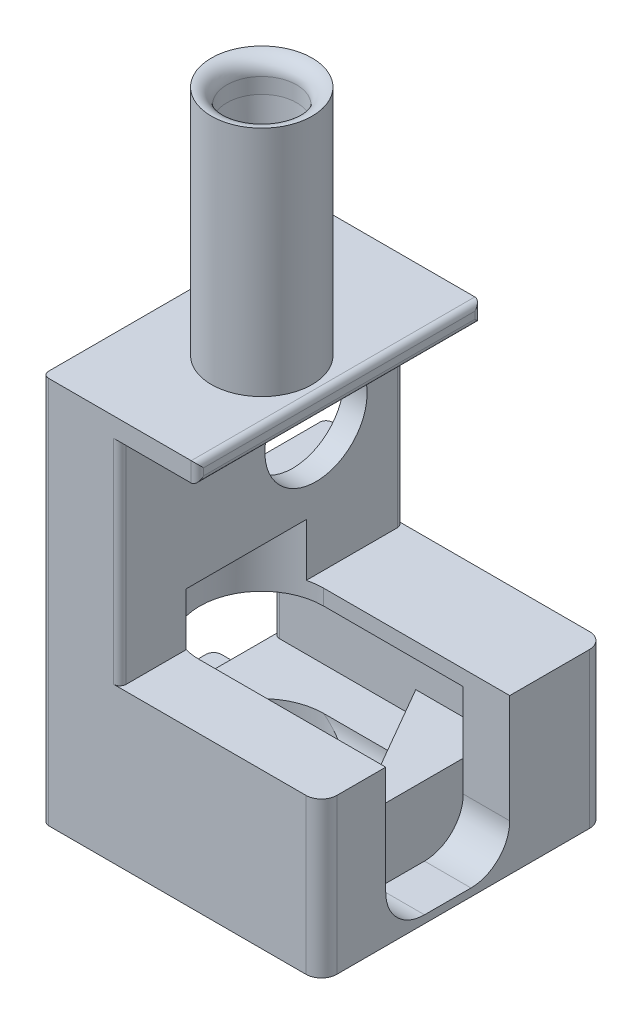
from build123d import *

# Parameters (mm, degrees)
SKETCH1_W                        = 12
SKETCH1_H                        = 13
BOSS_EXTRUDE1_DEPTH              = 19
SKETCH2_R                        = 4
CUT_EXTRUDE1_DEPTH               = 16
CUT_EXTRUDE2_START               = -2
SKETCH3_W                        = 12
SKETCH3_H                        = 13
CUT_EXTRUDE2_DEPTH               = 6
SKETCH5_W                        = 12
SKETCH5_H                        = 13
BOSS_EXTRUDE2_DEPTH              = 5
FILLET1_R                        = 2
FILLET4_R                        = 2
SKETCH21_W                       = 2.5
SKETCH21_H                       = 8
SKETCH21_W_2                     = 9
SKETCH21_H_2                     = 1.5
BOSS_EXTRUDE4_DEPTH              = 1.6
FILLET3_R                        = 0.5
FILLET7_R                        = 0.5
FILLET5_R                        = 0.5
SKETCH23_R                       = 4
BOSS_EXTRUDE5_DEPTH              = 1
BOSS_EXTRUDE6_DEPTH              = 13
BOSS_EXTRUDE7_DEPTH              = 25
SKETCH34_W                       = 13.5
SKETCH34_H                       = 6
CUT_EXTRUDE5_DEPTH               = 15
M2_5_CLEARANCE_HOLE1_D           = 2.9
M2_5_CLEARANCE_HOLE1_DEPTH       = 19.128752102
M2_5_CLEARANCE_HOLE1_TIP         = 0.871247898
FILLET8_R                        = 0.4
SKETCH31_R                       = 3.25
SKETCH31_R_2                     = 2.25
BOSS_EXTRUDE8_DEPTH              = 15
FILLET9_R                        = 1
SKETCH9_R                        = 1
CUT_EXTRUDE6_DEPTH               = 29.903676278
CUT_EXTRUDE8_DEPTH               = 12
BOSS_EXTRUDE9_START              = -2.5
BOSS_EXTRUDE9_DEPTH              = 4.5
FILLET10_R                       = 1
CUT_EXTRUDE9_REACH               = 45.94
SKETCH48_W                       = 12
SKETCH48_H                       = 15
CUT_EXTRUDE10_START              = -2.5
CUT_EXTRUDE10_DEPTH              = 5.5
SKETCH50_W                       = 16.3
SKETCH50_H                       = 8
CUT_EXTRUDE11_DEPTH              = 1
CUT_EXTRUDE13_DEPTH              = 8
SKETCH51_W                       = 2.5
SKETCH51_H                       = 8
BOSS_EXTRUDE10_DEPTH             = 5
BOSS_EXTRUDE10_DIRECTION_2_REACH = 43.91
CUT_EXTRUDE12_DEPTH              = 2.5
CUT_EXTRUDE14_START              = -1.25
CUT_EXTRUDE14_DEPTH              = 5.5
BOSS_EXTRUDE11_DEPTH             = 1.25
SKETCH58_R                       = 3.3
CUT_EXTRUDE16_DEPTH              = 6.6
SKETCH65_W                       = 1
SKETCH65_H                       = 16.3
CUT_EXTRUDE17_DEPTH              = 7
BOSS_EXTRUDE12_DEPTH             = 2
FILLET11_R                       = 1
CUT_EXTRUDE18_DEPTH              = 6.75
BOSS_EXTRUDE13_DEPTH             = 6.75
FILLET12_R                       = 0.4
FILLET13_R                       = 0.4
BOSS_EXTRUDE18_DEPTH             = 1.5
BOSS_EXTRUDE19_REACH             = 44.344


with BuildPart() as part:
    # Sketch1 → Boss-Extrude1 (new body)
    with BuildSketch(Plane(origin=(0, 0, 0), x_dir=(1, 0, 0), z_dir=(0, 1, 0))):
        Rectangle(SKETCH1_W, SKETCH1_H)
    extrude(amount=BOSS_EXTRUDE1_DEPTH)

    # Sketch2 → Cut-Extrude1 (cut)
    with BuildSketch(Plane.XZ):
        with Locations(Location((0, 0, 0), (0, 0, 270))):
            Circle(SKETCH2_R)
    extrude(amount=-CUT_EXTRUDE1_DEPTH, mode=Mode.SUBTRACT)

    # Sketch3 → Cut-Extrude2 (cut)
    with BuildSketch(Plane.XZ.offset(CUT_EXTRUDE2_START)):
        Rectangle(SKETCH3_W, SKETCH3_H)
    extrude(amount=-CUT_EXTRUDE2_DEPTH, mode=Mode.SUBTRACT)


with BuildPart() as cut_extrude2_piece_1:
    # of the separate pieces the step leaves, piece 1, a body of its own (cut_extrude2_pieces)
    add(part.part.solids().sort_by_distance((-6, 8, 6.5))[0])

    # Sketch5 → Boss-Extrude2 (add)
    with BuildSketch(Plane(origin=(0, 19, 0), x_dir=(1, 0, 0), z_dir=(0, 1, 0))):
        Rectangle(SKETCH5_W, SKETCH5_H)
    extrude(amount=BOSS_EXTRUDE2_DEPTH)

    # Fillet1
    fillet1_edges = [cut_extrude2_piece_1.edges().sort_by_distance(p)[0] for p in [
        (-6, 16, -6.5),
        (-6, 16, 6.5),
    ]]
    fillet(fillet1_edges, radius=FILLET1_R)



with BuildPart() as cut_extrude2_piece_2:
    # of the separate pieces the step leaves, piece 2, a body of its own (cut_extrude2_pieces)
    add(part.part.solids().sort_by_distance((-6, 0, 6.5))[0])

    # Fillet4
    fillet4_edges = [cut_extrude2_piece_2.edges().sort_by_distance(p)[0] for p in [
        (-6, 1, 6.5),
        (-6, 1, -6.5),
    ]]
    fillet(fillet4_edges, radius=FILLET4_R)

    # Sketch21 → Boss-Extrude4 (add)
    with BuildSketch(Plane.ZY.offset(6)):
        with Locations((-3.25, 18)):
            Rectangle(SKETCH21_W, SKETCH21_H)
        with Locations((3.25, 18)):
            Rectangle(SKETCH21_W, SKETCH21_H)
        with Locations((0, 0.75)):
            Rectangle(SKETCH21_W_2, SKETCH21_H_2)
    extrude(amount=BOSS_EXTRUDE4_DEPTH)


with BuildPart() as boss_extrude4_piece_1:
    # of the separate pieces the step leaves, piece 1, a body of its own (boss_extrude4_pieces)
    add(cut_extrude2_piece_2.part.solids().sort_by_distance((-4, 0, 6.5))[0])

    # Fillet5
    fillet5_edges = [boss_extrude4_piece_1.edges().sort_by_distance(p)[0] for p in [
        (-7.6, 0.75, -4.5),
        (-7.6, 0.75, 4.5),
    ]]
    fillet(fillet5_edges, radius=FILLET5_R)

    # Sketch23 → Boss-Extrude5 (add)
    with BuildSketch(Plane.XZ):
        with BuildLine():
            Line((-7.6, 4), (-7.6, -4))
            ThreePointArc((-7.6, -4), (-7.453553391, -4.353553391), (-7.1, -4.5))
            Line((-7.1, -4.5), (-6, -4.5))
            ThreePointArc((-6, -4.5), (-5.414213562, -5.914213562), (-4, -6.5))
            Line((-4, -6.5), (6, -6.5))
            Line((6, -6.5), (6, 6.5))
            Line((6, 6.5), (-4, 6.5))
            ThreePointArc((-4, 6.5), (-5.414213562, 5.914213562), (-6, 4.5))
            Line((-6, 4.5), (-7.1, 4.5))
            ThreePointArc((-7.1, 4.5), (-7.453553391, 4.353553391), (-7.6, 4))
        make_face()
        with Locations(Location((0, 0, 0), (0, 0, 270))):
            Circle(SKETCH23_R, mode=Mode.SUBTRACT)
    extrude(amount=BOSS_EXTRUDE5_DEPTH)


with BuildPart() as boss_extrude4_piece_2:
    # of the separate pieces the step leaves, piece 2, a body of its own (boss_extrude4_pieces)
    add(cut_extrude2_piece_2.part.solids().sort_by_distance((-6, 22, -4.5))[0])

    # Fillet7
    fillet7_edges = [boss_extrude4_piece_2.edges().sort_by_distance(p)[0] for p in [
        (-7.6, 18, -2),
        (-7.6, 22, -3.25),
        (-7.6, 18, -4.5),
        (-7.6, 14, -3.25),
    ]]
    fillet(fillet7_edges, radius=FILLET7_R)


with BuildPart() as boss_extrude4_piece_3:
    # of the separate pieces the step leaves, piece 3, a body of its own (boss_extrude4_pieces)
    add(cut_extrude2_piece_2.part.solids().sort_by_distance((-6, 22, 2))[0])

    # Fillet3
    fillet3_edges = [boss_extrude4_piece_3.edges().sort_by_distance(p)[0] for p in [
        (-7.6, 22, 3.25),
        (-7.6, 18, 2),
        (-7.6, 14, 3.25),
        (-7.6, 18, 4.5),
    ]]
    fillet(fillet3_edges, radius=FILLET3_R)


with BuildPart() as cut_extrude2_piece_1_1:
    add(cut_extrude2_piece_1.part)

    add(boss_extrude4_piece_1.part)  # Boss-Extrude6 merges Boss-Extrude4 piece 1
    # Sketch26 → Boss-Extrude6 (add, through all)
    with BuildSketch(Plane(origin=(0, 0, -6.5), x_dir=(-1, 0, 0), z_dir=(0, 0, -1))):
        Polygon((-6, 24), (-12, 24), (-12, -1), (-6, -1), (-6, 2), (-9, 2), (-9, 8), (-6, 8), align=None)
    extrude(amount=-BOSS_EXTRUDE6_DEPTH)


    add(boss_extrude4_piece_2.part)  # Boss-Extrude7 merges Boss-Extrude4 piece 2

    add(boss_extrude4_piece_3.part)  # Boss-Extrude7 merges Boss-Extrude4 piece 3
    # Sketch30 → Boss-Extrude7 (add, through all)
    with BuildSketch(Plane(origin=(0, 24, 0), x_dir=(1, 0, 0), z_dir=(0, 1, 0))):
        with BuildLine():
            ThreePointArc((-6, 4.5), (-5.414213562, 5.914213562), (-4, 6.5))
            Line((-4, 6.5), (12, 6.5))
            Line((12, 6.5), (12, 8.15))
            Line((12, 8.15), (-6, 8.15))
            Line((-6, 8.15), (-6, 4.5))
        make_face()
        with BuildLine():
            Line((12, -6.5), (-4, -6.5))
            ThreePointArc((-4, -6.5), (-5.414213562, -5.914213562), (-6, -4.5))
            Line((-6, -4.5), (-6, -8.15))
            Line((-6, -8.15), (12, -8.15))
            Line((12, -8.15), (12, -6.5))
        make_face()
    extrude(amount=-BOSS_EXTRUDE7_DEPTH)

    # Sketch34 → Cut-Extrude5 (cut)
    with BuildSketch(Plane.ZY.offset(6)):
        with Locations((0, 5)):
            Rectangle(SKETCH34_W, SKETCH34_H)
    extrude(amount=-CUT_EXTRUDE5_DEPTH, mode=Mode.SUBTRACT)

    # M2.5 Clearance Hole1
    with Locations(Plane(origin=(12, 0, 0), x_dir=(0, 0, -1), z_dir=(1, 0, 0))):
        with Locations((4.5, 17.5)):
            Hole(M2_5_CLEARANCE_HOLE1_D / 2, depth=M2_5_CLEARANCE_HOLE1_DEPTH)
            with Locations((0, 0, -(M2_5_CLEARANCE_HOLE1_DEPTH + M2_5_CLEARANCE_HOLE1_TIP / 2))):  # 118° drill point
                Cone(0, M2_5_CLEARANCE_HOLE1_D / 2, M2_5_CLEARANCE_HOLE1_TIP, mode=Mode.SUBTRACT)

    # Fillet8
    fillet8_edges = [cut_extrude2_piece_1_1.edges().sort_by_distance(p)[0] for p in [
        (-6, 11.5, 8.15),
        (-6, 5, 6.75),
        (-6, 5, -6.75),
    ]]
    fillet(fillet8_edges, radius=FILLET8_R)

    # Sketch31 → Boss-Extrude8 (add)
    with BuildSketch(Plane(origin=(0, 24, 0), x_dir=(1, 0, 0), z_dir=(0, 1, 0))):
        with Locations(Location((0, 0, 0), (0, 0, 90))):
            Circle(SKETCH31_R)
        with Locations(Location((0, 0, 0), (0, 0, 270))):
            Circle(SKETCH31_R_2, mode=Mode.SUBTRACT)
    extrude(amount=BOSS_EXTRUDE8_DEPTH)

    # Fillet9
    fillet9_edges = [cut_extrude2_piece_1_1.edges().sort_by_distance(p)[0] for p in [
        (12, 11.5, 8.15),
    ]]
    fillet(fillet9_edges, radius=FILLET9_R)

    # Sketch9 → Cut-Extrude6 (cut, through all)
    with BuildSketch(Plane(origin=(0, 24, 0), x_dir=(1, 0, 0), z_dir=(0, 1, 0))):
        with Locations(Location((0, 0, 0), (0, 0, 270))):
            Circle(SKETCH9_R)
    extrude(amount=-CUT_EXTRUDE6_DEPTH, mode=Mode.SUBTRACT)

    # Sketch42 → Cut-Extrude8 (cut)
    with BuildSketch(Plane(origin=(12, 0, 0), x_dir=(0, 0, -1), z_dir=(1, 0, 0))):
        with BuildLine():
            Line((-1.5, 13.5), (1.5, 13.5))
            ThreePointArc((1.5, 13.5), (3.267766953, 12.767766953), (4, 11))
            Line((4, 11), (4, 2))
            ThreePointArc((4, 2), (3.267766953, 0.232233047), (1.5, -0.5))
            Line((1.5, -0.5), (-1.5, -0.5))
            ThreePointArc((-1.5, -0.5), (-3.267766953, 0.232233047), (-4, 2))
            Line((-4, 2), (-4, 11))
            ThreePointArc((-4, 11), (-3.267766953, 12.767766953), (-1.5, 13.5))
        make_face()
    extrude(amount=-CUT_EXTRUDE8_DEPTH, mode=Mode.SUBTRACT)

    # Sketch43 → Revolve1 (revolve)
    with BuildSketch(Plane.XY, mode=Mode.PRIVATE) as revolve1_sk:
        Polygon((1.5, 24), (2.25, 24), (2.25, 37), align=None)
    revolve(revolve1_sk.sketch.rotate(Axis((0, 39, 0), (0, -1, 0)), 180), axis=Axis((0, 39, 0), (0, -1, 0)))

    # Sketch45 → Boss-Extrude9 (add)
    with BuildSketch(Plane(origin=(0, 2, 0), x_dir=(1, 0, 0), z_dir=(0, 1, 0)).offset(BOSS_EXTRUDE9_START)):
        Polygon((3.637306696, -6.3), (7.274613392, 0), (3.637306696, 6.3), (9, 6.3), (9, -6.3), align=None)
    extrude(amount=BOSS_EXTRUDE9_DEPTH)

    # Fillet10
    fillet10_edges = [cut_extrude2_piece_1_1.edges().sort_by_distance(p)[0] for p in [
        (0, 39, -2.25),
    ]]
    fillet(fillet10_edges, radius=FILLET10_R - 0.0001)  # a hair under: the kernel refuses the full size

    # Cut-Extrude9: up to this face of the body (flat: up to its plane)
    cut_extrude9_end = Plane(cut_extrude2_piece_1_1.part.faces().sort_by_distance((3, 11.5, -8.15))[0])
    # Sketch48 → Cut-Extrude9 (cut, up to the picked face)
    with BuildSketch(Plane.XY.offset(8.15), mode=Mode.PRIVATE) as cut_extrude9_sk1:
        with Locations((6, 16.5)):
            Rectangle(SKETCH48_W, SKETCH48_H)
    cut_extrude9_tool1 = split(extrude(cut_extrude9_sk1.sketch, amount=-CUT_EXTRUDE9_REACH, mode=Mode.PRIVATE), bisect_by=cut_extrude9_end, keep=Keep.BOTH, mode=Mode.PRIVATE)
    add(cut_extrude9_tool1.solids().sort_by(Axis((6, 16.5, 8.15), (0, 0, -1)))[0], mode=Mode.SUBTRACT)

    # Sketch49 → Cut-Extrude10 (cut)
    with BuildSketch(Plane(origin=(0, 0, 0), x_dir=(0, 0, -1), z_dir=(1, 0, 0)).offset(CUT_EXTRUDE10_START)):
        Polygon((7.444486373, 22.6), (8.15, 22.6), (8.15, 12.4), (7.444486373, 12.4), (1.555513627, 12.4), (-1.388972746, 17.5), (1.555513627, 22.6), align=None)
    extrude(amount=-CUT_EXTRUDE10_DEPTH, mode=Mode.SUBTRACT)

    # Sketch50 → Cut-Extrude11 (cut)
    with BuildSketch(Plane(origin=(0, 0, 0), x_dir=(0, 0, -1), z_dir=(1, 0, 0))):
        with Locations((0, 20)):
            Rectangle(SKETCH50_W, SKETCH50_H)
    extrude(amount=-CUT_EXTRUDE11_DEPTH, mode=Mode.SUBTRACT)

    # Sketch56 → Cut-Extrude13 (cut)
    with BuildSketch(Plane(origin=(0, 24, 0), x_dir=(1, 0, 0), z_dir=(0, 1, 0))):
        Polygon((-1, -8.15), (-1, -0.65), (-4, -8.15), align=None)
    extrude(amount=-CUT_EXTRUDE13_DEPTH, mode=Mode.SUBTRACT)

    # Sketch51 → Boss-Extrude10 (add)
    with BuildSketch(Plane(origin=(-1, 0, 0), x_dir=(0, 0, -1), z_dir=(1, 0, 0))):
        with Locations((-5.9, 20)):
            Rectangle(SKETCH51_W, SKETCH51_H)
    extrude(amount=BOSS_EXTRUDE10_DEPTH)

    # Boss-Extrude10 direction 2: up to this plane
    boss_extrude10_direction_2_end = Plane(origin=(-1, 7.922252789, 0.65), z_dir=(-0.9284766908852594, 0, -0.3713906763541036))
    # Sketch51 → Boss-Extrude10 direction 2 (add, up to the surface)
    with BuildSketch(Plane(origin=(-1, 0, 0), x_dir=(0, 0, -1), z_dir=(1, 0, 0)), mode=Mode.PRIVATE) as boss_extrude10_direction_2_sk1:
        with Locations((-5.9, 20)):
            Rectangle(SKETCH51_W, SKETCH51_H)
    boss_extrude10_direction_2_tool1 = split(extrude(boss_extrude10_direction_2_sk1.sketch, amount=-BOSS_EXTRUDE10_DIRECTION_2_REACH, mode=Mode.PRIVATE), bisect_by=boss_extrude10_direction_2_end, keep=Keep.BOTH, mode=Mode.PRIVATE)
    add(boss_extrude10_direction_2_tool1.solids().sort_by_distance((-1, 20, 5.9))[0])

    # Sketch54 → Cut-Extrude12 (cut)
    with BuildSketch(Plane(origin=(0, 0, 4.65), x_dir=(-1, 0, 0), z_dir=(0, 0, -1))):
        with BuildLine():
            Line((1.35, 22.75), (2.6, 22.75))
            Line((2.6, 22.75), (2.6, 20.25))
            Line((2.6, 20.25), (2.6, 19.75))
            Line((2.6, 19.75), (2.6, 17.25))
            Line((2.6, 17.25), (1.35, 17.25))
            ThreePointArc((1.35, 17.25), (0.466116524, 17.616116524), (0.1, 18.5))
            Line((0.1, 18.5), (0.1, 21.5))
            ThreePointArc((0.1, 21.5), (0.466116524, 22.383883476), (1.35, 22.75))
        make_face()
    extrude(amount=-CUT_EXTRUDE12_DEPTH, mode=Mode.SUBTRACT)

    # Sketch57 → Cut-Extrude14 (cut)
    with BuildSketch(Plane(origin=(0, 24, 0), x_dir=(1, 0, 0), z_dir=(0, 1, 0)).offset(CUT_EXTRUDE14_START)):
        Polygon((-2.6, -4.65), (-3.6, -7.15), (-2.6, -7.15), align=None)
    extrude(amount=-CUT_EXTRUDE14_DEPTH, mode=Mode.SUBTRACT)

    # Sketch59 → Boss-Extrude11 (add)
    with BuildSketch(Plane.XZ.offset(-24)):
        with BuildLine():
            Line((-1, -1.118033989), (-1, -8.15))
            Line((-1, -8.15), (4, -8.15))
            Line((4, -8.15), (4, 8.15))
            Line((4, 8.15), (-1.133139947, 8.15))
            Line((-1.133139947, 8.15), (-4, 8.15))
            Line((-4, 8.15), (-1.133139947, 0.982849867))
            ThreePointArc((-1.133139947, 0.982849867), (1.496996911, 0.094869637), (-1, -1.118033989))
        make_face()
    extrude(amount=BOSS_EXTRUDE11_DEPTH)

    # Sketch58 → Cut-Extrude16 (cut)
    with BuildSketch(Plane(origin=(-1, 0, 0), x_dir=(0, 0, -1), z_dir=(1, 0, 0))):
        with Locations((4.5, 17.5)):
            Circle(SKETCH58_R)
    extrude(amount=-CUT_EXTRUDE16_DEPTH, mode=Mode.SUBTRACT)

    # Sketch65 → Cut-Extrude17 (cut)
    with BuildSketch(Plane(origin=(0, 16, 0), x_dir=(1, 0, 0), z_dir=(0, 1, 0))):
        with Locations((-0.5, 0)):
            Rectangle(SKETCH65_W, SKETCH65_H)
    extrude(amount=-CUT_EXTRUDE17_DEPTH, mode=Mode.SUBTRACT)

    # Sketch67 → Boss-Extrude12 (add)
    with BuildSketch(Plane(origin=(0, 0, -8.15), x_dir=(-1, 0, 0), z_dir=(0, 0, -1))):
        Polygon((6, -1), (6, 12.4), (2.5, 12.4), (2.5, 22.6), (6, 22.6), (6, 24), (-4, 24), (-4, 22.75), (1, 22.75), (1, 9), (-12, 9), (-12, -1), align=None)
    extrude(amount=BOSS_EXTRUDE12_DEPTH)

    # Fillet11
    fillet11_edges = [cut_extrude2_piece_1_1.edges().sort_by_distance(p)[0] for p in [
        (12, 4, -10.15),
    ]]
    fillet(fillet11_edges, radius=FILLET11_R)

    # Sketch68 → Cut-Extrude18 (cut)
    with BuildSketch(Plane.XZ.offset(-16)):
        Polygon((4, 4.65), (-2.6, 4.65), (-3.309686066, 6.424215166), (-3.6, 7.15), (-2.6, 7.15), (4, 7.15), align=None)
    extrude(amount=-CUT_EXTRUDE18_DEPTH, mode=Mode.SUBTRACT)

    # Sketch69 → Boss-Extrude13 (add)
    with BuildSketch(Plane(origin=(0, 16, 0), x_dir=(1, 0, 0), z_dir=(0, 1, 0))):
        Polygon((-4, -8.15), (-1, -8.15), (-1, -0.65), align=None)
    extrude(amount=BOSS_EXTRUDE13_DEPTH)

    # Fillet12
    fillet12_edges = [cut_extrude2_piece_1_1.edges().sort_by_distance(p)[0] for p in [
        (-6, 5.7, -10.15),
        (-6, 23.3, -10.15),
    ]]
    fillet(fillet12_edges, radius=FILLET12_R)

    # Fillet13
    fillet13_edges = [cut_extrude2_piece_1_1.edges().sort_by_distance(p)[0] for p in [
        (4, 24, -1),
        (4, 22.75, -1),
        (4, 23.375, 8.15),
        (-1, 15.875, 8.15),
        (-1, 15.875, -10.15),
        (4, 23.375, -10.15),
    ]]
    fillet(fillet13_edges, radius=FILLET13_R)

    # Sketch74 → Boss-Extrude18 (add)
    with BuildSketch(Plane(origin=(-1, 0, 0), x_dir=(0, 0, -1), z_dir=(1, 0, 0))):
        with BuildLine():
            Line((1.555513627, 12.4), (3.122498999, 12.4))
            Line((3.122498999, 12.4), (3.872983346, 12.4))
            Line((3.872983346, 12.4), (3.872983346, 14.260115725))
            ThreePointArc((3.872983346, 14.260115725), (2.515910962, 14.863071732), (1.560612309, 16))
            Line((1.560612309, 16), (-0.522947342, 16))
            Line((-0.522947342, 16), (1.555513627, 12.4))
        make_face()
    extrude(amount=-BOSS_EXTRUDE18_DEPTH)

    # Sketch75 → Boss-Extrude19 (add, up to next)
    with BuildSketch(Plane(origin=(-1, 0, 0), x_dir=(0, 0, -1), z_dir=(1, 0, 0)), mode=Mode.PRIVATE) as boss_extrude19_sk1:
        Polygon((1.555513627, 12.4), (-3.872983346, 12.4), (-3.872983346, 16), (-0.522947342, 16), align=None)
    boss_extrude19_tool1 = extrude(boss_extrude19_sk1.sketch, amount=-BOSS_EXTRUDE19_REACH, mode=Mode.PRIVATE) - cut_extrude2_piece_1_1.part
    add(boss_extrude19_tool1.solids().sort_by_distance((-1, 14.05794, 1.637341))[0])


solid = cut_extrude2_piece_1_1.part
